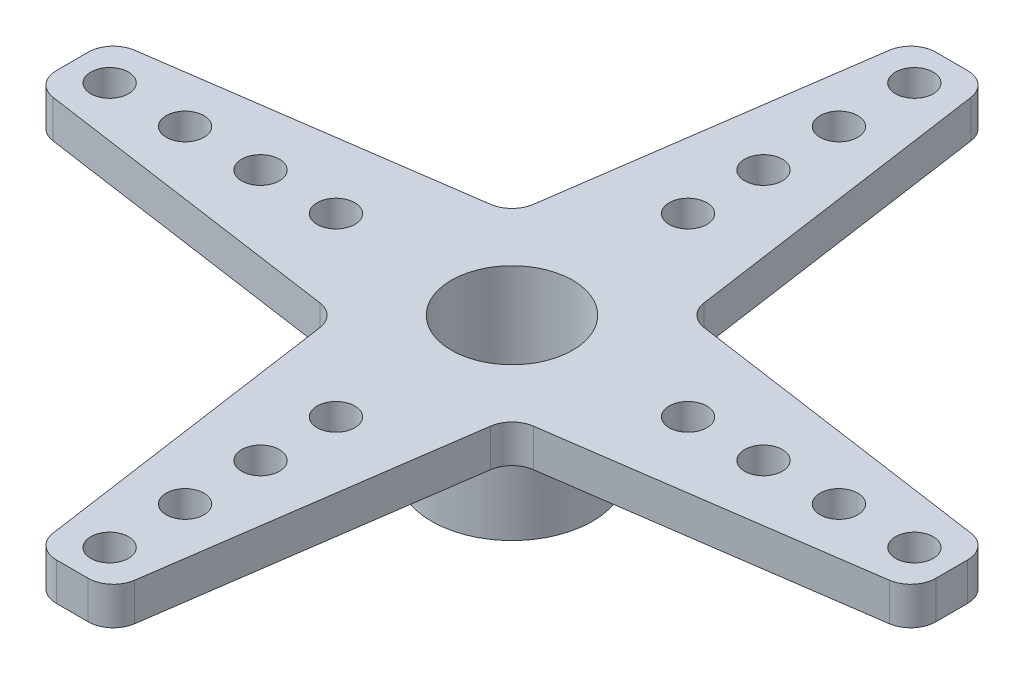
from build123d import *

# Parameters (mm, degrees)
SKETCH1_R           = 2.413
SKETCH1_R_2         = 0.75
BOSS_EXTRUDE1_DEPTH = 1.5
BOSS_EXTRUDE2_START = 4
SKETCH2_R           = 3.2
SKETCH2_R_2         = 2.413
BOSS_EXTRUDE2_DEPTH = 4
FILLET1_R           = 1


with BuildPart() as part:
    # Sketch1 → Boss-Extrude1 (new body)
    with BuildSketch(Plane(origin=(0, 0, 0), x_dir=(1, 0, 0), z_dir=(0, 1, 0))):
        Polygon((-1.5, 17.48474988), (-3.5, 3.5), (-17.48474988, 1.5), (-17.48474988, -1.5), (-3.5, -3.5), (-1.5, -17.48474988), (1.5, -17.48474988), (3.5, -3.5), (17.48474988, -1.5), (17.48474988, 1.5), (3.5, 3.5), (1.5, 17.48474988), align=None)
        Circle(SKETCH1_R, mode=Mode.SUBTRACT)
        with Locations((7, 0)):
            Circle(SKETCH1_R_2, mode=Mode.SUBTRACT)
        with Locations((10, 0)):
            Circle(SKETCH1_R_2, mode=Mode.SUBTRACT)
        with Locations((13, 0)):
            Circle(SKETCH1_R_2, mode=Mode.SUBTRACT)
        with Locations((16, 0)):
            Circle(SKETCH1_R_2, mode=Mode.SUBTRACT)
        with Locations((0, -7)):
            Circle(SKETCH1_R_2, mode=Mode.SUBTRACT)
        with Locations((0, -10)):
            Circle(SKETCH1_R_2, mode=Mode.SUBTRACT)
        with Locations((0, -13)):
            Circle(SKETCH1_R_2, mode=Mode.SUBTRACT)
        with Locations((0, -16)):
            Circle(SKETCH1_R_2, mode=Mode.SUBTRACT)
        with Locations((-7, 0)):
            Circle(SKETCH1_R_2, mode=Mode.SUBTRACT)
        with Locations((-10, 0)):
            Circle(SKETCH1_R_2, mode=Mode.SUBTRACT)
        with Locations((-13, 0)):
            Circle(SKETCH1_R_2, mode=Mode.SUBTRACT)
        with Locations((-16, 0)):
            Circle(SKETCH1_R_2, mode=Mode.SUBTRACT)
        with Locations((0, 7)):
            Circle(SKETCH1_R_2, mode=Mode.SUBTRACT)
        with Locations((0, 10)):
            Circle(SKETCH1_R_2, mode=Mode.SUBTRACT)
        with Locations((0, 13)):
            Circle(SKETCH1_R_2, mode=Mode.SUBTRACT)
        with Locations((0, 16)):
            Circle(SKETCH1_R_2, mode=Mode.SUBTRACT)
    extrude(amount=BOSS_EXTRUDE1_DEPTH)

    # Sketch2 → Boss-Extrude2 (add)
    with BuildSketch(Plane.XZ.offset(BOSS_EXTRUDE2_START)):
        Circle(SKETCH2_R)
        Circle(SKETCH2_R_2, mode=Mode.SUBTRACT)
    extrude(amount=-BOSS_EXTRUDE2_DEPTH)

    # Fillet1
    fillet1_edges = [part.edges().sort_by_distance(p)[0] for p in [
        (-3.5, 0.75, -3.5),
        (-1.5, 0.75, -17.48474988),
        (1.5, 0.75, -17.48474988),
        (3.5, 0.75, -3.5),
        (17.48474988, 0.75, -1.5),
        (17.48474988, 0.75, 1.5),
        (3.5, 0.75, 3.5),
        (1.5, 0.75, 17.48474988),
        (-1.5, 0.75, 17.48474988),
        (-3.5, 0.75, 3.5),
        (-17.48474988, 0.75, -1.5),
        (-17.48474988, 0.75, 1.5),
    ]]
    fillet(fillet1_edges, radius=FILLET1_R)


solid = part.part
